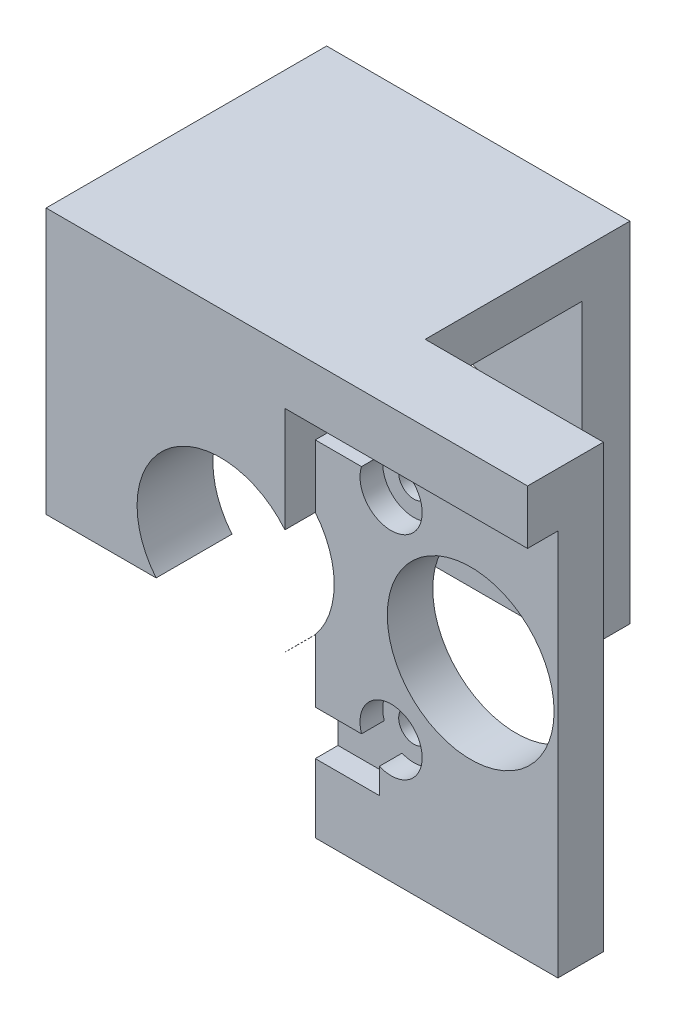
from build123d import *

# Parameters (mm, degrees)
SKETCH1_W           = 93
SKETCH1_H           = 100
BOSS_EXTRUDE2_DEPTH = 10
SKETCH4_W           = 10.01
SKETCH4_H           = 15
BOSS_EXTRUDE4_DEPTH = 24
SKETCH5_R           = 2
CUT_EXTRUDE1_DEPTH  = 50
SKETCH7_R           = 11
CUT_EXTRUDE3_DEPTH  = 50
SKETCH14_W          = 61.5
SKETCH14_H          = 42
CUT_EXTRUDE8_DEPTH  = 4
SKETCH19_R          = 11
CUT_EXTRUDE11_DEPTH = 15
SKETCH20_R          = 2
CUT_EXTRUDE12_DEPTH = 10
SKETCH21_W          = 40
SKETCH21_H          = 6
BOSS_EXTRUDE5_DEPTH = 27
SKETCH22_W          = 40
SKETCH22_H          = 6.3
BOSS_EXTRUDE7_DEPTH = 40
SKETCH23_R          = 8
CUT_EXTRUDE13_DEPTH = 40
SKETCH24_W          = 118.277817783
SKETCH24_H          = 41.8
CUT_EXTRUDE14_DEPTH = 40
SKETCH25_W          = 31.5
SKETCH25_H          = 23.2
CUT_EXTRUDE15_DEPTH = 20
CUT_EXTRUDE18_DEPTH = 3
SKETCH27_R          = 4.1
SKETCH27_R_2        = 4
CUT_EXTRUDE29_DEPTH = 3
SKETCH28_W          = 29.5
SKETCH28_H          = 58.2
CUT_EXTRUDE30_DEPTH = 23
SKETCH29_W          = 32
SKETCH29_H          = 4
CUT_EXTRUDE31_DEPTH = 23


with BuildPart() as part:
    # Sketch1 → Boss-Extrude2 (new body)
    with BuildSketch(Plane.XY):
        with Locations((-29.68705036, 14.928057554)):
            Rectangle(SKETCH1_W, SKETCH1_H)
    extrude(amount=BOSS_EXTRUDE2_DEPTH)

    # Sketch4 → Boss-Extrude4 (add)
    with BuildSketch(Plane(origin=(16.81294964, 0, 0), x_dir=(0, 0, -1), z_dir=(1, 0, 0))):
        with Locations((-4.995, -12.571942446)):
            Rectangle(SKETCH4_W, SKETCH4_H)
    extrude(amount=BOSS_EXTRUDE4_DEPTH)

    # Sketch5 → Cut-Extrude1 (cut)
    with BuildSketch(Plane(origin=(0, -5.071942446, 0), x_dir=(1, 0, 0), z_dir=(0, 1, 0))):
        with Locations((26.81294964, -5)):
            Circle(SKETCH5_R)
    extrude(amount=-CUT_EXTRUDE1_DEPTH, mode=Mode.SUBTRACT)

    # Sketch7 → Cut-Extrude3 (cut)
    with BuildSketch(Plane(origin=(0, 0, 0), x_dir=(-1, 0, 0), z_dir=(0, 0, -1))):
        with Locations((24.18705036, 36.928057554)):
            Circle(SKETCH7_R)
    extrude(amount=-CUT_EXTRUDE3_DEPTH, mode=Mode.SUBTRACT)

    # Sketch14 → Cut-Extrude8 (cut)
    with BuildSketch(Plane.XY.offset(10)):
        with Locations((-13.93705036, 36.789132279)):
            Rectangle(SKETCH14_W, SKETCH14_H)
    extrude(amount=-CUT_EXTRUDE8_DEPTH, mode=Mode.SUBTRACT)

    # Sketch19 → Cut-Extrude11 (cut)
    with BuildSketch(Plane(origin=(0, 0, 0), x_dir=(-1, 0, 0), z_dir=(0, 0, -1))):
        with Locations((53.18705036, 36.928057554)):
            Circle(SKETCH19_R)
    extrude(amount=-CUT_EXTRUDE11_DEPTH, mode=Mode.SUBTRACT)

    # Sketch20 → Cut-Extrude12 (cut)
    with BuildSketch(Plane.XY.offset(6)):
        with Locations((-34.68705036, 50.928057554)):
            Circle(SKETCH20_R)
        with Locations((5.31294964, 50.928057554)):
            Circle(SKETCH20_R)
        with Locations((-34.68705036, 22.928057554)):
            Circle(SKETCH20_R)
        with Locations((5.31294964, 22.928057554)):
            Circle(SKETCH20_R)
    extrude(amount=-CUT_EXTRUDE12_DEPTH, mode=Mode.SUBTRACT)

    # Sketch21 → Boss-Extrude5 (add)
    with BuildSketch(Plane(origin=(0, 0, 0), x_dir=(-1, 0, 0), z_dir=(0, 0, -1))):
        with Locations((56.18705036, 61.928057554)):
            Rectangle(SKETCH21_W, SKETCH21_H)
    extrude(amount=BOSS_EXTRUDE5_DEPTH)

    # Sketch22 → Boss-Extrude7 (add)
    with BuildSketch(Plane.XZ.offset(-58.928057554)):
        with Locations((-56.18705036, -23.85)):
            Rectangle(SKETCH22_W, SKETCH22_H)
    extrude(amount=BOSS_EXTRUDE7_DEPTH)

    # Sketch23 → Cut-Extrude13 (cut)
    with BuildSketch(Plane.XY.offset(10)):
        with Locations((-53.18705036, 36.928057554)):
            Circle(SKETCH23_R)
    extrude(amount=-CUT_EXTRUDE13_DEPTH, mode=Mode.SUBTRACT)

    # Sketch24 → Cut-Extrude14 (cut)
    with BuildSketch(Plane.XY.offset(10)):
        with Locations((-17.048141468, -14.171942446)):
            Rectangle(SKETCH24_W, SKETCH24_H)
    extrude(amount=-CUT_EXTRUDE14_DEPTH, mode=Mode.SUBTRACT)

    # Sketch25 → Cut-Extrude15 (cut)
    with BuildSketch(Plane.XY.offset(10)):
        with Locations((-60.43705036, 18.328057554)):
            Rectangle(SKETCH25_W, SKETCH25_H)
    extrude(amount=-CUT_EXTRUDE15_DEPTH, mode=Mode.SUBTRACT)

    # Sketch26 → Cut-Extrude18 (cut)
    with BuildSketch(Plane.XY.offset(6)):
        with BuildLine():
            Line((-44.68705036, 21.664686216), (-44.68705036, 15.789132279))
            Line((-44.68705036, 15.789132279), (-36.237499605, 15.789132279))
            Line((-36.237499605, 15.789132279), (-36.237499605, 19.240767609))
            ThreePointArc((-36.237499605, 19.240767609), (-37.621834849, 20.210146592), (-38.482296447, 21.664686216))
            Line((-38.482296447, 21.664686216), (-44.68705036, 21.664686216))
        make_face()
        with BuildLine():
            Line((6.863398886, 19.240767609), (6.863398886, 15.789132279))
            Line((6.863398886, 15.789132279), (14.30212304, 15.789132279))
            Line((14.30212304, 15.789132279), (14.30212304, 20.928057554))
            Line((14.30212304, 20.928057554), (8.777051255, 20.928057554))
            ThreePointArc((8.777051255, 20.928057554), (7.95835451, 19.927752057), (6.863398886, 19.240767609))
        make_face()
        with BuildLine():
            Line((14.30212304, 57.789132279), (6.863398886, 57.789132279))
            Line((6.863398886, 57.789132279), (6.863398886, 54.615347499))
            ThreePointArc((6.863398886, 54.615347499), (8.24773413, 53.645968516), (9.108195728, 52.191428892))
            Line((9.108195728, 52.191428892), (14.30212304, 52.191428892))
            Line((14.30212304, 52.191428892), (14.30212304, 57.789132279))
        make_face()
        with BuildLine():
            Line((-36.237499605, 57.789132279), (-44.68705036, 57.789132279))
            Line((-44.68705036, 57.789132279), (-44.68705036, 52.191428892))
            Line((-44.68705036, 52.191428892), (-38.482296447, 52.191428892))
            ThreePointArc((-38.482296447, 52.191428892), (-37.621834849, 53.645968516), (-36.237499605, 54.615347499))
            Line((-36.237499605, 54.615347499), (-36.237499605, 57.789132279))
        make_face()
    extrude(amount=-CUT_EXTRUDE18_DEPTH, mode=Mode.SUBTRACT)

    # Sketch27 → Cut-Extrude29 (cut)
    with BuildSketch(Plane.XY.offset(6)):
        with Locations((5.31294964, 50.928057554)):
            Circle(SKETCH27_R)
        with Locations((5.31294964, 22.928057554)):
            Circle(SKETCH27_R_2)
        with Locations((-34.68705036, 50.928057554)):
            Circle(SKETCH27_R)
        with Locations((-34.68705036, 22.928057554)):
            Circle(SKETCH27_R)
    extrude(amount=-CUT_EXTRUDE29_DEPTH, mode=Mode.SUBTRACT)

    # Sketch28 → Cut-Extrude30 (cut)
    with BuildSketch(Plane(origin=(0, 0, 0), x_dir=(-1, 0, 0), z_dir=(0, 0, -1))):
        with Locations((-2.06294964, 35.828057554)):
            Rectangle(SKETCH28_W, SKETCH28_H)
    extrude(amount=-CUT_EXTRUDE30_DEPTH, mode=Mode.SUBTRACT)

    # Sketch29 → Cut-Extrude31 (cut)
    with BuildSketch(Plane(origin=(0, 15.789132279, 0), x_dir=(1, 0, 0), z_dir=(0, 1, 0))):
        with Locations((-28.68705036, -8)):
            Rectangle(SKETCH29_W, SKETCH29_H)
    extrude(amount=-CUT_EXTRUDE31_DEPTH, mode=Mode.SUBTRACT)


solid = part.part
